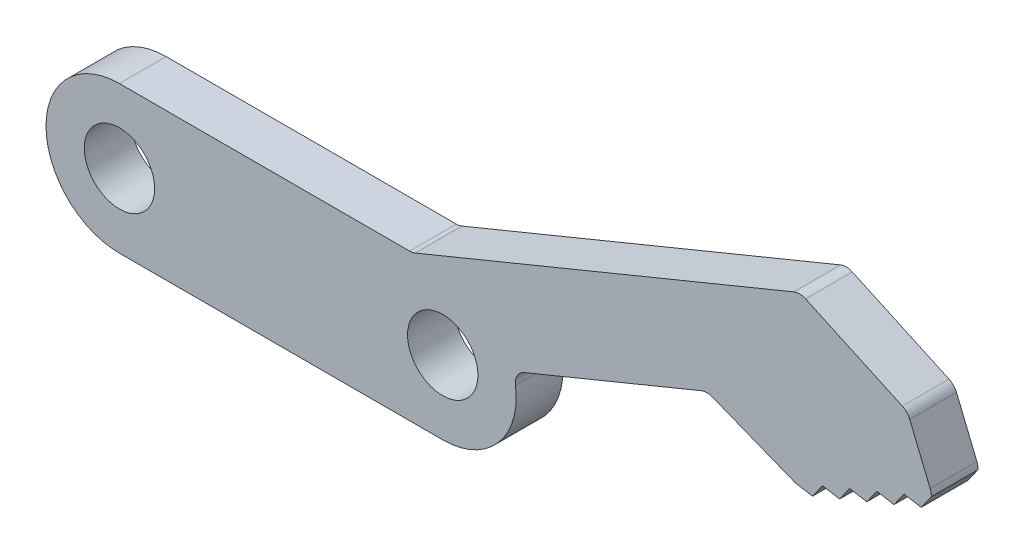
from build123d import *

# Parameters (mm, degrees)
SKETCH1_R           = 2.395
BOSS_EXTRUDE1_DEPTH = 3.18
FILLET1_R           = 1


with BuildPart() as part:
    # Sketch1 → Boss-Extrude1 (new body)
    # profile 1 of 2: a face of its own
    with BuildSketch(Plane.XY):
        with BuildLine():
            Line((46.303280967, 15.837507263), (19.944251464, 5))
            Line((19.944251464, 5), (22, 5))
            ThreePointArc((22, 5), (24.987746861, 4.009160597), (26.791342796, 1.429347478))
            Line((26.791342796, 1.429347478), (39.978778977, 6.851358003))
            Line((39.978778977, 6.851358003), (45.999791823, 4.461390287))
            Line((45.999791823, 4.461390287), (47.164236001, 4.258980416))
            Line((47.164236001, 4.258980416), (47.849548279, 5.221917112))
            Line((47.849548279, 5.221917112), (49.013992457, 5.019507241))
            Line((49.013992457, 5.019507241), (49.699304735, 5.982443937))
            Line((49.699304735, 5.982443937), (50.863748914, 5.780034066))
            Line((50.863748914, 5.780034066), (51.549061192, 6.742970763))
            Line((51.549061192, 6.742970763), (52.71350537, 6.540560892))
            Line((52.71350537, 6.540560892), (53.398817648, 7.503497588))
            Line((53.398817648, 7.503497588), (54.563261826, 7.301087717))
            Line((54.563261826, 7.301087717), (55.248574104, 8.264024414))
            Line((55.248574104, 8.264024414), (55.347176821, 8.304564892))
            Line((55.347176821, 8.304564892), (53.635991464, 12.466516919))
            Line((53.635991464, 12.466516919), (46.303280967, 15.837507263))
        make_face()
    # profile 2 of 2: a face of its own
    with BuildSketch(Plane.XY):
        with BuildLine():
            ThreePointArc((22, -5), (27, 0), (22, 5))
            Line((22, 5), (0, 5))
            ThreePointArc((0, 5), (-5, 0), (0, -5))
            Line((0, -5), (22, -5))
        make_face()
        with Locations(Location((22, 0, 0), (0, 0, 180))):
            Circle(SKETCH1_R, mode=Mode.SUBTRACT)
        with Locations(Location((0, 0, 0), (0, 0, 180))):
            Circle(SKETCH1_R, mode=Mode.SUBTRACT)
    extrude(amount=BOSS_EXTRUDE1_DEPTH)

    # Fillet1
    # the kernel refuses this fillet: 1 mm, written as the material it adds along each edge
    with BuildSketch(Plane(origin=(39.978778977, 6.851358003, 0), x_dir=(-0.9248782281665482, -0.3802634127332084, 0), z_dir=(0, 0, 1))) as fillet1_piece_1:
        with BuildLine():
            CenterArc((FILLET1_R * 0.404026225835, FILLET1_R), FILLET1_R, 226, 44)
            Line((-FILLET1_R * 0.290632144624, FILLET1_R * 0.280660199661), (0, 0))
            Line((0, 0), (FILLET1_R * 0.404026225835, 0))
        make_face()
    extrude(amount=3.18)
    with BuildSketch(Plane(origin=(26.791342796, 1.429347478, 0), x_dir=(0.9248782281665486, 0.38026341273320724, 0), z_dir=(0, 0, 1))) as fillet1_piece_2:
        with BuildLine():
            CenterArc((0.834537834, -1), FILLET1_R, 90, 75.522487814)
            ThreePointArc((-0.133708003, -0.75), (-0.052548991, -0.377550259), (0, 0))
            Line((0, 0), (0.834537834, 0))
        make_face()
    extrude(amount=3.18)
    with BuildSketch(Plane(origin=(19.944251464, 5, 0), x_dir=(0.9248782281665495, 0.3802634127332051, 0), z_dir=(0, 0, 1))) as fillet1_piece_3:
        with BuildLine():
            CenterArc((FILLET1_R * 0.197551931945, FILLET1_R), FILLET1_R, 247.65, 22.35)
            Line((-FILLET1_R * 0.182711480788, FILLET1_R * 0.0751217718334), (0, 0))
            Line((0, 0), (FILLET1_R * 0.197551931945, 0))
        make_face()
    extrude(amount=3.18)
    # the kernel refuses this fillet: 1 mm, written as the material it takes off along each edge
    with BuildSketch(Plane(origin=(46.303280967, 15.837507263, -1.088047115), x_dir=(-0.9248782281665417, -0.38026341273322406, 0), z_dir=(0, 0, 1))) as fillet1_2_piece_1:
        with BuildLine():
            CenterArc((FILLET1_R * 0.43521884585, FILLET1_R), FILLET1_R, 222.960833652, 47.039166348)
            Line((-FILLET1_R * 0.296600886481, FILLET1_R * 0.318501739275), (0, 0))
            Line((0, 0), (FILLET1_R * 0.43521884585, 0))
        make_face()
    extrude(amount=5.356094229, mode=Mode.SUBTRACT)
    with BuildSketch(Plane(origin=(53.635991464, 12.466516919, -0.983789259), x_dir=(-0.9085871727996149, 0.41769528298031194, 0), z_dir=(0, 0, 1))) as fillet1_2_piece_2:
        with BuildLine():
            CenterArc((FILLET1_R * 0.393515703744, FILLET1_R), FILLET1_R, 227.039166348, 42.960833652)
            Line((-FILLET1_R * 0.287982556982, FILLET1_R * 0.268180267669), (0, 0))
            Line((0, 0), (FILLET1_R * 0.393515703744, 0))
        make_face()
    extrude(amount=5.147578519, mode=Mode.SUBTRACT)
    with BuildSketch(Plane(origin=(55.347176821, 8.304564892, -1.123212767), x_dir=(-0.9248782281666527, -0.38026341273295444, 0), z_dir=(0, 0, 1))) as fillet1_2_piece_3:
        with BuildLine():
            CenterArc((1, -0.449285107), FILLET1_R, 153.302173601, 26.697826399)
            Line((0, -0.449285107), (0, 0))
            Line((0, 0), (0.106611567, 0))
        make_face()
    extrude(amount=5.426425535, mode=Mode.SUBTRACT)


solid = part.part
